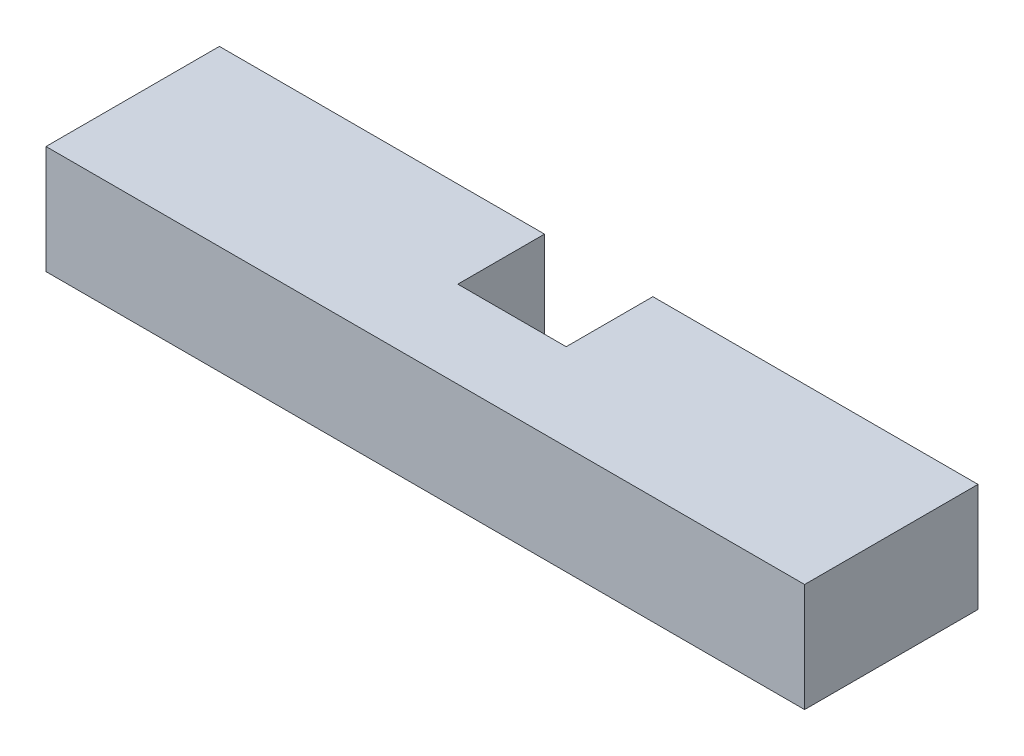
from build123d import *

# Parameters (mm, degrees)
BOSS_EXTRUDE1_DEPTH = 6.35


with BuildPart() as part:
    # Elevator Paddle Support Strut → Boss-Extrude1 (new body)
    with BuildSketch(Plane(origin=(0, 0, 0), x_dir=(1, 0, 0), z_dir=(0, 1, 0))):
        Polygon((-22.225, 5.08), (-22.225, -5.08), (22.225, -5.08), (22.225, 5.08), (3.175, 5.08), (3.175, 0), (-3.175, 0), (-3.175, 5.08), align=None)
    extrude(amount=BOSS_EXTRUDE1_DEPTH)


solid = part.part
